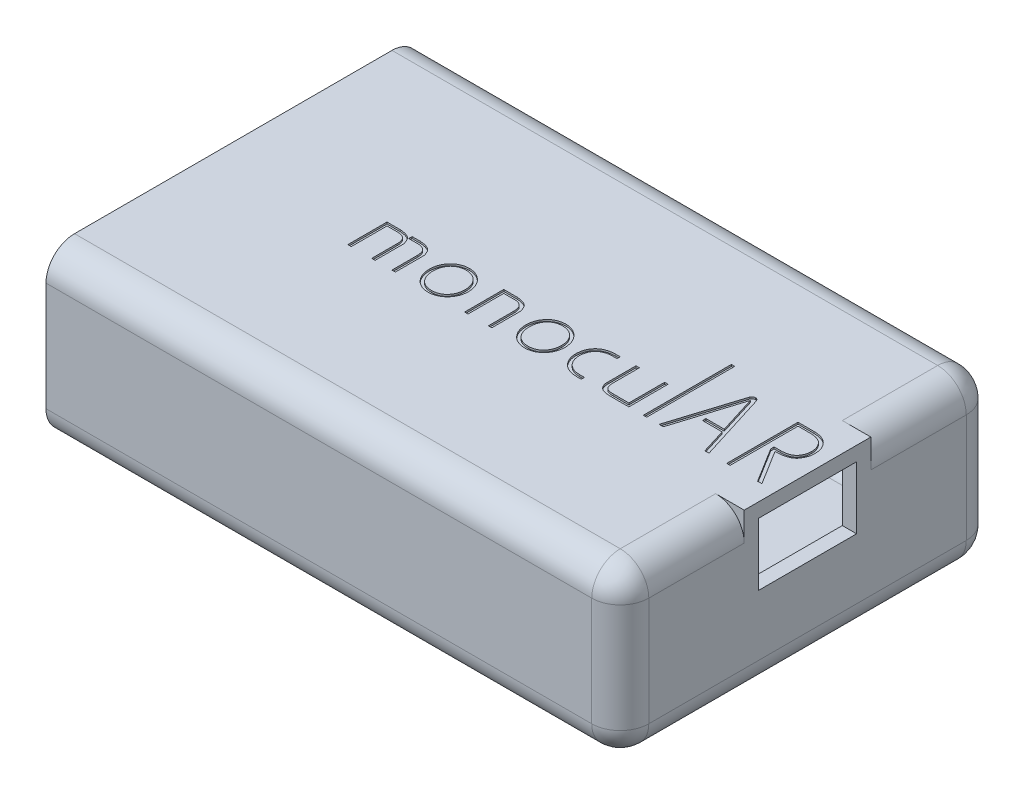
from build123d import *

# Parameters (mm, degrees)
SKETCH1_W                      = 64
SKETCH1_H                      = 42
BOSS_EXTRUDE1_DEPTH            = 1.6
SKETCH2_W                      = 64
SKETCH2_H                      = 42
SKETCH2_W_2                    = 60.8
SKETCH2_H_2                    = 38.8
BOSS_EXTRUDE2_DEPTH            = 17
SKETCH3_W                      = 60.8
SKETCH3_H                      = 5
BOSS_EXTRUDE3_DEPTH            = 5
SKETCH4_W                      = 11
SKETCH4_H                      = 8
CUT_EXTRUDE1_DEPTH             = 5
SKETCH5_R                      = 2
CUT_EXTRUDE2_DEPTH             = 5
CUT_EXTRUDE3_DEPTH             = 5
LPATTERN1_COUNT                = 2
LPATTERN1_PITCH                = 7
SKETCH6_W                      = 60.8
SKETCH6_H                      = 38.8
BOSS_EXTRUDE4_DEPTH            = 1.6
CUT_EXTRUDE8_REACH             = 53.216
SKETCH17_W                     = 9
SKETCH17_H                     = 3.4
CUT_EXTRUDE8_DIRECTION_2_REACH = 53.216
FILLET1_R                      = 1.6
FILLET2_R                      = 3.2
BOSS_EXTRUDE5_START            = -7.1
BOSS_EXTRUDE5_DEPTH            = 14.2
BOSS_EXTRUDE5_2_DEPTH          = 1.6
BOSS_EXTRUDE5_START_2          = 5.5
BOSS_EXTRUDE5_3_DEPTH          = 1.6
SKETCH19_W                     = 0.37518747
SKETCH19_H                     = 9.870561159
CUT_EXTRUDE9_DEPTH             = 0.2
CUT_EXTRUDE10_DEPTH            = 1.6
BOSS_EXTRUDE6_START            = 2
BOSS_EXTRUDE6_DEPTH            = 2


# Read off the part's stored shape, not the designer's step: Boss-Extrude5
with BuildPart() as part:
    # Sketch1 → Boss-Extrude1 (new body)
    with BuildSketch(Plane(origin=(0, 0, 0), x_dir=(1, 0, 0), z_dir=(0, 1, 0))):
        Rectangle(SKETCH1_W, SKETCH1_H)
    extrude(amount=BOSS_EXTRUDE1_DEPTH)

    # Sketch2 → Boss-Extrude2 (add)
    with BuildSketch(Plane(origin=(0, 1.6, 0), x_dir=(1, 0, 0), z_dir=(0, 1, 0))):
        Rectangle(SKETCH2_W, SKETCH2_H)
        Rectangle(SKETCH2_W_2, SKETCH2_H_2, mode=Mode.SUBTRACT)
    extrude(amount=BOSS_EXTRUDE2_DEPTH)

    # Sketch3 → Boss-Extrude3 (add)
    with BuildSketch(Plane(origin=(0, 1.6, 0), x_dir=(1, 0, 0), z_dir=(0, 1, 0))):
        with Locations((0, 16.9)):
            Rectangle(SKETCH3_W, SKETCH3_H)
        with Locations((0, -16.9)):
            Rectangle(SKETCH3_W, SKETCH3_H)
    boss_extrude3 = extrude(amount=BOSS_EXTRUDE3_DEPTH)

    # Sketch4 → Cut-Extrude1 (cut)
    with BuildSketch(Plane(origin=(32, 0, 0), x_dir=(0, 0, -1), z_dir=(1, 0, 0))):
        with Locations((0, 14)):
            Rectangle(SKETCH4_W, SKETCH4_H)
    extrude(amount=-CUT_EXTRUDE1_DEPTH, mode=Mode.SUBTRACT)

    # Sketch5 → Cut-Extrude2 (cut)
    with BuildSketch(Plane.ZY.offset(32)):
        with Locations((0, 12)):
            Circle(SKETCH5_R)
    extrude(amount=-CUT_EXTRUDE2_DEPTH, mode=Mode.SUBTRACT)

    # Sketch7 → Cut-Extrude3 (cut)
    with BuildSketch(Plane(origin=(0, 6.6, 0), x_dir=(1, 0, 0), z_dir=(0, 1, 0))):
        Polygon((-26.4, 14.4), (-21.4, 19.4), (21.4, 19.4), (26.4, 14.4), align=None)
        Polygon((21.4, -19.4), (26.4, -14.4), (-26.4, -14.4), (-21.4, -19.4), align=None)
    cut_extrude3 = extrude(amount=-CUT_EXTRUDE3_DEPTH, mode=Mode.SUBTRACT)

    # LPattern1: Boss-Extrude3, Cut-Extrude3 ×2
    with Locations(*[(0, i * LPATTERN1_PITCH, 0) for i in range(1, LPATTERN1_COUNT)]):
        add(boss_extrude3)
        add(cut_extrude3, mode=Mode.SUBTRACT)

    # Sketch6 → Boss-Extrude4 (add)
    with BuildSketch(Plane(origin=(0, 18.6, 0), x_dir=(1, 0, 0), z_dir=(0, 1, 0))):
        Rectangle(SKETCH6_W, SKETCH6_H)
    extrude(amount=-BOSS_EXTRUDE4_DEPTH)

    # Cut-Extrude8: up to this face of the body (flat: up to its plane)
    cut_extrude8_end = Plane(part.part.faces().sort_by_distance((0, 9.704590649, -19.4))[0])
    # Sketch17 → Cut-Extrude8 (cut, up to the picked face)
    with BuildSketch(Plane.XY.offset(-14.4), mode=Mode.PRIVATE) as cut_extrude8_sk1:
        with Locations((-25.9, 11.9)):
            Rectangle(SKETCH17_W, SKETCH17_H)
    cut_extrude8_tool1 = split(extrude(cut_extrude8_sk1.sketch, amount=-CUT_EXTRUDE8_REACH, mode=Mode.PRIVATE), bisect_by=cut_extrude8_end, keep=Keep.BOTH, mode=Mode.PRIVATE)
    # Sketch17 → Cut-Extrude8 (cut, up to the picked face)
    with BuildSketch(Plane.XY.offset(-14.4), mode=Mode.PRIVATE) as cut_extrude8_sk2:
        with Locations((25.9, 11.9)):
            Rectangle(SKETCH17_W, SKETCH17_H)
    cut_extrude8_tool2 = split(extrude(cut_extrude8_sk2.sketch, amount=-CUT_EXTRUDE8_REACH, mode=Mode.PRIVATE), bisect_by=cut_extrude8_end, keep=Keep.BOTH, mode=Mode.PRIVATE)
    # Sketch17 → Cut-Extrude8 (cut, up to the picked face)
    with BuildSketch(Plane.XY.offset(-14.4), mode=Mode.PRIVATE) as cut_extrude8_sk3:
        with Locations((-25.9, 3.3)):
            Rectangle(SKETCH17_W, SKETCH17_H)
    cut_extrude8_tool3 = split(extrude(cut_extrude8_sk3.sketch, amount=-CUT_EXTRUDE8_REACH, mode=Mode.PRIVATE), bisect_by=cut_extrude8_end, keep=Keep.BOTH, mode=Mode.PRIVATE)
    # Sketch17 → Cut-Extrude8 (cut, up to the picked face)
    with BuildSketch(Plane.XY.offset(-14.4), mode=Mode.PRIVATE) as cut_extrude8_sk4:
        with Locations((25.9, 3.3)):
            Rectangle(SKETCH17_W, SKETCH17_H)
    cut_extrude8_tool4 = split(extrude(cut_extrude8_sk4.sketch, amount=-CUT_EXTRUDE8_REACH, mode=Mode.PRIVATE), bisect_by=cut_extrude8_end, keep=Keep.BOTH, mode=Mode.PRIVATE)
    add(cut_extrude8_tool1.solids().sort_by(Axis((-25.9, 11.9, -14.4), (0, 0, -1)))[0], mode=Mode.SUBTRACT)
    add(cut_extrude8_tool2.solids().sort_by(Axis((25.9, 11.9, -14.4), (0, 0, -1)))[0], mode=Mode.SUBTRACT)
    add(cut_extrude8_tool3.solids().sort_by(Axis((-25.9, 3.3, -14.4), (0, 0, -1)))[0], mode=Mode.SUBTRACT)
    add(cut_extrude8_tool4.solids().sort_by(Axis((25.9, 3.3, -14.4), (0, 0, -1)))[0], mode=Mode.SUBTRACT)

    # Cut-Extrude8 direction 2: up to this face of the body (flat: up to its plane)
    cut_extrude8_direction_2_end = Plane(part.part.faces().sort_by_distance((0, 9.704590649, 19.4))[0])
    # Sketch17 → Cut-Extrude8 direction 2 (cut, up to the picked face)
    with BuildSketch(Plane.XY.offset(-14.4), mode=Mode.PRIVATE) as cut_extrude8_direction_2_sk1:
        with Locations((-25.9, 11.9)):
            Rectangle(SKETCH17_W, SKETCH17_H)
    cut_extrude8_direction_2_tool1 = split(extrude(cut_extrude8_direction_2_sk1.sketch, amount=CUT_EXTRUDE8_DIRECTION_2_REACH, mode=Mode.PRIVATE), bisect_by=cut_extrude8_direction_2_end, keep=Keep.BOTH, mode=Mode.PRIVATE)
    # Sketch17 → Cut-Extrude8 direction 2 (cut, up to the picked face)
    with BuildSketch(Plane.XY.offset(-14.4), mode=Mode.PRIVATE) as cut_extrude8_direction_2_sk2:
        with Locations((25.9, 11.9)):
            Rectangle(SKETCH17_W, SKETCH17_H)
    cut_extrude8_direction_2_tool2 = split(extrude(cut_extrude8_direction_2_sk2.sketch, amount=CUT_EXTRUDE8_DIRECTION_2_REACH, mode=Mode.PRIVATE), bisect_by=cut_extrude8_direction_2_end, keep=Keep.BOTH, mode=Mode.PRIVATE)
    # Sketch17 → Cut-Extrude8 direction 2 (cut, up to the picked face)
    with BuildSketch(Plane.XY.offset(-14.4), mode=Mode.PRIVATE) as cut_extrude8_direction_2_sk3:
        with Locations((-25.9, 3.3)):
            Rectangle(SKETCH17_W, SKETCH17_H)
    cut_extrude8_direction_2_tool3 = split(extrude(cut_extrude8_direction_2_sk3.sketch, amount=CUT_EXTRUDE8_DIRECTION_2_REACH, mode=Mode.PRIVATE), bisect_by=cut_extrude8_direction_2_end, keep=Keep.BOTH, mode=Mode.PRIVATE)
    # Sketch17 → Cut-Extrude8 direction 2 (cut, up to the picked face)
    with BuildSketch(Plane.XY.offset(-14.4), mode=Mode.PRIVATE) as cut_extrude8_direction_2_sk4:
        with Locations((25.9, 3.3)):
            Rectangle(SKETCH17_W, SKETCH17_H)
    cut_extrude8_direction_2_tool4 = split(extrude(cut_extrude8_direction_2_sk4.sketch, amount=CUT_EXTRUDE8_DIRECTION_2_REACH, mode=Mode.PRIVATE), bisect_by=cut_extrude8_direction_2_end, keep=Keep.BOTH, mode=Mode.PRIVATE)
    add(cut_extrude8_direction_2_tool1.solids().sort_by(Axis((-25.9, 11.9, -14.4), (0, 0, 1)))[0], mode=Mode.SUBTRACT)
    add(cut_extrude8_direction_2_tool2.solids().sort_by(Axis((25.9, 11.9, -14.4), (0, 0, 1)))[0], mode=Mode.SUBTRACT)
    add(cut_extrude8_direction_2_tool3.solids().sort_by(Axis((-25.9, 3.3, -14.4), (0, 0, 1)))[0], mode=Mode.SUBTRACT)
    add(cut_extrude8_direction_2_tool4.solids().sort_by(Axis((25.9, 3.3, -14.4), (0, 0, 1)))[0], mode=Mode.SUBTRACT)

    # Fillet1
    fillet1_edges = [part.edges().sort_by_distance(p)[0] for p in [
        (0, 1.6, 19.4),
        (30.4, 7.6, -19.4),
        (30.4, 7.6, 19.4),
        (30.4, 13.6, -19.4),
        (30.4, 13.6, 19.4),
        (30.4, 17, -12.45),
        (30.4, 17, 12.45),
        (0, 17, 19.4),
        (0, 17, -19.4),
        (30.4, 3.3, 19.4),
        (30.4, 3.3, -19.4),
        (30.4, 1.6, 0),
        (0, 1.6, -19.4),
    ]]
    fillet(fillet1_edges, radius=FILLET1_R)

    # Fillet2
    # the kernel refuses this fillet: 3.2 mm, written as the material it takes off along each edge
    with BuildSketch(Plane(origin=(28.8, 3.2, -17.8), x_dir=(0, -1, 0), z_dir=(0, 0, -1))) as fillet2_piece_1_section:
        Polygon((0, 0), (FILLET2_R, 0), (FILLET2_R, -FILLET2_R), (0, -FILLET2_R), align=None)
    fillet2_piece_1 = extrude(amount=FILLET2_R, mode=Mode.PRIVATE)
    fillet2_piece_1 = fillet2_piece_1 - Plane(origin=(28.8, 3.2, -17.8), x_dir=(-0.7071067811865475, 0.7071067811865475, 0), z_dir=(0, 0, -1)) * Sphere(FILLET2_R, mode=Mode.PRIVATE)
    add(fillet2_piece_1, mode=Mode.SUBTRACT)
    with BuildSketch(Plane(origin=(28.8, 15.4, -17.8), x_dir=(0, 1, 0), z_dir=(0, 0, -1))) as fillet2_piece_2_section:
        Polygon((0, 0), (FILLET2_R, 0), (FILLET2_R, FILLET2_R), (0, FILLET2_R), align=None)
    fillet2_piece_2 = extrude(amount=FILLET2_R, mode=Mode.PRIVATE)
    fillet2_piece_2 = fillet2_piece_2 - Plane(origin=(28.8, 15.4, -17.8), x_dir=(-0.7071067811865475, -0.7071067811865475, 0), z_dir=(0, 0, -1)) * Sphere(FILLET2_R, mode=Mode.PRIVATE)
    add(fillet2_piece_2, mode=Mode.SUBTRACT)
    with BuildSketch(Plane(origin=(28.8, 3.2, 17.8), x_dir=(0, 0, 1), z_dir=(0, -1, 0))) as fillet2_piece_3_section:
        Polygon((0, 0), (FILLET2_R, 0), (FILLET2_R, -FILLET2_R), (0, -FILLET2_R), align=None)
    fillet2_piece_3 = extrude(amount=FILLET2_R, mode=Mode.PRIVATE)
    fillet2_piece_3 = fillet2_piece_3 - Plane(origin=(28.8, 3.2, 17.8), x_dir=(-0.7071067811865475, 0, -0.7071067811865475), z_dir=(0, -1, 0)) * Sphere(FILLET2_R, mode=Mode.PRIVATE)
    add(fillet2_piece_3, mode=Mode.SUBTRACT)
    with BuildSketch(Plane(origin=(28.8, 15.4, 17.8), x_dir=(0, 0, 1), z_dir=(0, 1, 0))) as fillet2_piece_4_section:
        Polygon((0, 0), (FILLET2_R, 0), (FILLET2_R, FILLET2_R), (0, FILLET2_R), align=None)
    fillet2_piece_4 = extrude(amount=FILLET2_R, mode=Mode.PRIVATE)
    fillet2_piece_4 = fillet2_piece_4 - Plane(origin=(28.8, 15.4, 17.8), x_dir=(-0.7071067811865475, 0, -0.7071067811865475), z_dir=(0, 1, 0)) * Sphere(FILLET2_R, mode=Mode.PRIVATE)
    add(fillet2_piece_4, mode=Mode.SUBTRACT)
    with BuildSketch(Plane(origin=(-40, 0, -21), x_dir=(0, 1, 0), z_dir=(1, 0, 0)), Plane(origin=(28.8, 18.6, -21), x_dir=(0, -1, 0), z_dir=(-1, 0, 0))) as fillet2_piece_5:
        with BuildLine():
            CenterArc((FILLET2_R, FILLET2_R), FILLET2_R, 180, 90)
            Line((0, FILLET2_R), (0, 0))
            Line((0, 0), (FILLET2_R, 0))
        make_face()
    extrude(amount=68.8, mode=Mode.SUBTRACT)
    with BuildSketch(Plane(origin=(28.8, 0, 21), x_dir=(0, 0, -1), z_dir=(-1, 0, 0)), Plane(origin=(-40, 18.6, 21), x_dir=(0, 0, -1), z_dir=(1, 0, 0))) as fillet2_piece_6:
        with BuildLine():
            CenterArc((FILLET2_R, -FILLET2_R), FILLET2_R, 90, 90)
            Line((0, -FILLET2_R), (0, 0))
            Line((0, 0), (FILLET2_R, 0))
        make_face()
    extrude(amount=68.8, mode=Mode.SUBTRACT)
    with BuildSketch(Plane(origin=(32, 15.4, 21), x_dir=(0, 0, -1), z_dir=(0, -1, 0))) as fillet2_piece_7:
        with BuildLine():
            CenterArc((FILLET2_R, -FILLET2_R), FILLET2_R, 90, 90)
            Line((0, -FILLET2_R), (0, 0))
            Line((0, 0), (FILLET2_R, 0))
        make_face()
    extrude(amount=12.2, mode=Mode.SUBTRACT)
    with BuildSketch(Plane(origin=(32, 0, -17.8), x_dir=(0, 1, 0), z_dir=(0, 0, 1)), Plane(origin=(32, 18.6, 17.8), x_dir=(0, -1, 0), z_dir=(0, 0, -1))) as fillet2_piece_8:
        with BuildLine():
            CenterArc((FILLET2_R, FILLET2_R), FILLET2_R, 180, 90)
            Line((0, FILLET2_R), (0, 0))
            Line((0, 0), (FILLET2_R, 0))
        make_face()
    extrude(amount=35.6, mode=Mode.SUBTRACT)
    with BuildSketch(Plane(origin=(32, 15.4, -21), x_dir=(0, 0, 1), z_dir=(0, -1, 0))) as fillet2_piece_9:
        with BuildLine():
            CenterArc((FILLET2_R, FILLET2_R), FILLET2_R, 180, 90)
            Line((0, FILLET2_R), (0, 0))
            Line((0, 0), (FILLET2_R, 0))
        make_face()
    extrude(amount=12.2, mode=Mode.SUBTRACT)

    # Boss-Extrude5 outline → Boss-Extrude5 (add)
    with BuildSketch(Plane.XY.offset(BOSS_EXTRUDE5_START)):
        with BuildLine():
            Line((32, 17), (32, 18.6))
            Line((32, 18.6), (28.8, 18.6))
            ThreePointArc((28.8, 18.6), (29.779795897, 18.446309242), (30.665475811, 18))
            ThreePointArc((30.665475811, 18), (31.171682759, 17.548283243), (31.571281292, 17))
            Line((31.571281292, 17), (32, 17))
        make_face()
    extrude(amount=BOSS_EXTRUDE5_DEPTH)

    # Boss-Extrude5 2 outline → Boss-Extrude5 2 (add)
    with BuildSketch(Plane.XY.offset(BOSS_EXTRUDE5_START)):
        with BuildLine():
            Line((32, 15.4), (32, 17))
            Line((32, 17), (31.571281292, 17))
            ThreePointArc((31.571281292, 17), (31.890962644, 16.228220944), (32, 15.4))
        make_face()
    extrude(amount=BOSS_EXTRUDE5_2_DEPTH)

    # Boss-Extrude5 3 outline → Boss-Extrude5 3 (add)
    with BuildSketch(Plane.XY.offset(BOSS_EXTRUDE5_START_2)):
        with BuildLine():
            Line((32, 15.4), (32, 17))
            Line((32, 17), (31.571281292, 17))
            ThreePointArc((31.571281292, 17), (31.890962644, 16.228220944), (32, 15.4))
        make_face()
    extrude(amount=BOSS_EXTRUDE5_3_DEPTH)

    # Sketch19 → Cut-Extrude9 (cut)
    # profile 1 of 10: a face of its own
    with BuildSketch(Plane(origin=(0, 18.6, 0), x_dir=(1, 0, 0), z_dir=(0, 1, 0))):
        with BuildLine():
            Line((-16.010923418, 0.466698399), (-16.010923418, -3.54165131))
            Line((-16.010923418, -3.54165131), (-15.626787865, -3.54165131))
            Line((-15.626787865, -3.54165131), (-15.626787865, 0.466698399))
            Line((-15.626787865, 0.466698399), (-14.331548275, 0.466698399))
            add(Edge.make_bspline(
                [(-14.331548275, 0.466698399), (-14.253475036, 0.460378168), (-14.105901252, 0.448431687), (-13.90020776, 0.389229621), (-13.723683027, 0.297116206), (-13.579520364, 0.165418622), (-13.469134971, -0.002697445), (-13.393136522, -0.205112996), (-13.347333695, -0.440095566), (-13.343045309, -0.607532122), (-13.340775922, -0.696138514)],
                knots=[0, 0, 0, 0, 1.080076416, 2.041556939, 2.936302262, 3.807490633, 4.708824137, 5.689062843, 6.777066318, 8, 8, 8, 8], degree=3))
            Line((-13.340775922, -0.696138514), (-13.338690279, -3.54165131))
            Line((-13.338690279, -3.54165131), (-12.954554726, -3.54165131))
            Line((-12.954554726, -3.54165131), (-12.954554726, -0.383255309))
            add(Edge.make_bspline(
                [(-12.954554726, -0.383255309), (-12.951988732, -0.374874265), (-12.945515282, -0.3537307), (-12.9505077, -0.311905207), (-12.96378939, -0.25663612), (-12.984171838, -0.185663133), (-13.017111711, -0.102235459), (-13.056524647, -0.003004378), (-13.107040956, 0.109991937), (-13.162208059, 0.236189372), (-13.235106532, 0.364978223), (-13.339148699, 0.48047547), (-13.47006548, 0.578744701), (-13.6237069, 0.665866131), (-13.805657274, 0.732184535), (-14.010522641, 0.789518442), (-14.242334666, 0.827621269), (-14.405386113, 0.842836541), (-14.491088781, 0.850833952)],
                knots=[0, 0, 0, 0, 0.190487936, 0.480559988, 0.902239325, 1.442553576, 2.093856515, 2.866747362, 3.781625319, 4.804915956, 5.88479137, 7.007821731, 8.181851069, 9.458321067, 10.862678076, 12.412439398, 14.114315935, 16, 16, 16, 16], degree=3))
            Line((-14.491088781, 0.850833952), (-16.010923418, 0.850833952))
            Line((-16.010923418, 0.850833952), (-16.010923418, 0.466698399))
        make_face()
    # profile 2 of 10: a face of its own
    with BuildSketch(Plane(origin=(0, 18.6, 0), x_dir=(1, 0, 0), z_dir=(0, 1, 0))):
        with BuildLine():
            add(Edge.make_bspline(
                [(-10.683156557, -0.383255309), (-10.680590564, -0.374874266), (-10.674117117, -0.353730702), (-10.679109504, -0.311905191), (-10.692391398, -0.256636221), (-10.712772739, -0.185662598), (-10.745718115, -0.102238088), (-10.785104369, -0.002991664), (-10.835746701, 0.109932183), (-10.890504767, 0.236774434), (-10.966125313, 0.364958938), (-11.072173747, 0.481243082), (-11.207330058, 0.578603011), (-11.365471336, 0.666328086), (-11.553807898, 0.732378947), (-11.766373392, 0.789416339), (-12.007145769, 0.827730361), (-12.17643809, 0.842862493), (-12.26561962, 0.850833952)],
                knots=[0, 0, 0, 0, 0.186906199, 0.47152404, 0.885274559, 1.415429305, 2.054485822, 2.812844037, 3.710519583, 4.714569331, 5.781820712, 6.893741821, 8.0695373, 9.348175478, 10.76811625, 12.34650486, 14.075374696, 16, 16, 16, 16], degree=3))
            Line((-12.26561962, 0.850833952), (-13.187783888, 0.850833952))
            Line((-13.187783888, 0.850833952), (-13.187783888, 0.466698399))
            Line((-13.187783888, 0.466698399), (-12.100768164, 0.466698399))
            add(Edge.make_bspline(
                [(-12.100768164, 0.466698399), (-12.02034799, 0.460215758), (-11.867120404, 0.447864137), (-11.653138933, 0.390122498), (-11.469488255, 0.29716924), (-11.31892504, 0.166444318), (-11.203788013, -0.001914268), (-11.125976172, -0.204974136), (-11.077871866, -0.439910119), (-11.072316063, -0.60750319), (-11.069377753, -0.696138514)],
                knots=[0, 0, 0, 0, 1.093525226, 2.083534787, 2.987622984, 3.864660519, 4.760769052, 5.727247019, 6.798004018, 8, 8, 8, 8], degree=3))
            Line((-11.069377753, -0.696138514), (-11.06729211, -3.54165131))
            Line((-11.06729211, -3.54165131), (-10.683156557, -3.54165131))
            Line((-10.683156557, -3.54165131), (-10.683156557, -0.383255309))
        make_face()
    # profile 3 of 10: a face of its own
    with BuildSketch(Plane(origin=(0, 18.6, 0), x_dir=(1, 0, 0), z_dir=(0, 1, 0))):
        with BuildLine():
            add(Edge.make_bspline(
                [(-9.063117255, -1.345464745), (-9.060321184, -1.426962283), (-9.054827551, -1.587086117), (-9.023210395, -1.821179207), (-8.972536934, -2.0437091), (-8.90612723, -2.255836706), (-8.82072125, -2.456897249), (-8.714644446, -2.646447572), (-8.592041389, -2.825686609), (-8.451943653, -2.992502511), (-8.298249426, -3.145159135), (-8.130456351, -3.278702687), (-7.952354744, -3.395120782), (-7.761529534, -3.489242143), (-7.559237583, -3.561501469), (-7.347440366, -3.619164382), (-7.122739897, -3.65501781), (-6.968602441, -3.661506694), (-6.889838109, -3.664822518)],
                knots=[0, 0, 0, 0, 1.103541761, 2.168204605, 3.192193797, 4.190415089, 5.173943997, 6.143977171, 7.126603096, 8.109770911, 9.089139204, 10.054401994, 11.008286044, 11.964772276, 12.927502712, 13.912519732, 14.933296334, 16, 16, 16, 16], degree=3))
            add(Edge.make_bspline(
                [(-6.889838109, -3.664822518), (-6.812457816, -3.661510282), (-6.660386917, -3.655000941), (-6.437243982, -3.618565821), (-6.225183883, -3.561962114), (-6.02180689, -3.488815872), (-5.829100263, -3.394649741), (-5.647127962, -3.278904197), (-5.475122508, -3.144661465), (-5.315378835, -2.992667082), (-5.168920508, -2.826433676), (-5.042111442, -2.646572025), (-4.93228958, -2.456582113), (-4.83984713, -2.25653327), (-4.769043004, -2.04413206), (-4.717563708, -1.821048058), (-4.680344512, -1.588064041), (-4.673896922, -1.428364129), (-4.670631994, -1.347495342)],
                knots=[0, 0, 0, 0, 1.041884041, 2.047552901, 3.035970889, 3.993177267, 4.952581385, 5.916775597, 6.891200033, 7.885151451, 8.880955202, 9.868662672, 10.84236638, 11.831627444, 12.829939575, 13.85016276, 14.91136616, 16, 16, 16, 16], degree=3))
            add(Edge.make_bspline(
                [(-4.670631994, -1.347495342), (-4.673829533, -1.265925116), (-4.680090529, -1.106205165), (-4.717709307, -0.873246555), (-4.769535333, -0.650351228), (-4.838759978, -0.43730418), (-4.933529197, -0.237652378), (-5.041357276, -0.046604106), (-5.169030541, 0.13347079), (-5.315349291, 0.299780159), (-5.475130248, 0.451754251), (-5.647125929, 0.586002301), (-5.829100802, 0.701746445), (-6.021806746, 0.795912948), (-6.225183923, 0.86905909), (-6.437243971, 0.925662825), (-6.66038692, 0.962097938), (-6.812457817, 0.968607279), (-6.889838109, 0.971919516)],
                knots=[0, 0, 0, 0, 1.097395747, 2.14877417, 3.168450105, 4.175104593, 5.155331468, 6.1366309, 7.123808562, 8.119078161, 9.112496422, 10.086398174, 11.05007519, 12.008964682, 12.965657613, 13.953545411, 14.958674828, 16, 16, 16, 16], degree=3))
            add(Edge.make_bspline(
                [(-6.889838109, 0.971919516), (-6.96860244, 0.968603692), (-7.122739895, 0.962114807), (-7.347440377, 0.926261385), (-7.559237545, 0.868598447), (-7.761529676, 0.796339214), (-7.952354222, 0.702217509), (-8.130458306, 0.585800702), (-8.298241986, 0.452252263), (-8.451971905, 0.299614203), (-8.591935571, 0.132728574), (-8.715382713, -0.046754074), (-8.819520384, -0.237285781), (-8.907174976, -0.438047001), (-8.972021788, -0.650759365), (-9.02321461, -0.873105431), (-9.054420656, -1.106587333), (-9.061554866, -1.265987234), (-9.065202899, -1.347495342)],
                knots=[0, 0, 0, 0, 1.066702549, 2.087478082, 3.072494072, 4.0352235, 4.991708731, 5.945591781, 6.910853561, 7.890220829, 8.873387614, 9.856012511, 10.834291492, 11.809161745, 12.816367771, 13.840355892, 14.895679955, 16, 16, 16, 16], degree=3))
            Line((-9.065202899, -1.347495342), (-9.063117255, -1.345464745))
        make_face()
        with BuildLine():
            add(Edge.make_bspline(
                [(-5.054767546, -1.345464745), (-5.057944741, -1.417199766), (-5.06410199, -1.556218737), (-5.089673236, -1.759295806), (-5.128124563, -1.951869675), (-5.185286717, -2.132997621), (-5.254363543, -2.304758915), (-5.339156704, -2.465933293), (-5.443831382, -2.614013689), (-5.556833886, -2.75425708), (-5.685187126, -2.880108329), (-5.82508112, -2.990701246), (-5.975639602, -3.086071485), (-6.139053252, -3.159854714), (-6.309695381, -3.224497789), (-6.493612061, -3.267402463), (-6.687953785, -3.2945139), (-6.821551248, -3.300562058), (-6.889838109, -3.303653507)],
                knots=[0, 0, 0, 0, 1.144191134, 2.217386596, 3.259459877, 4.269939636, 5.240162759, 6.207846027, 7.164788291, 8.126348535, 9.075479422, 10.023118219, 10.964961006, 11.907848399, 12.876421374, 13.869210842, 14.910870754, 16, 16, 16, 16], degree=3))
            add(Edge.make_bspline(
                [(-6.889838109, -3.303653507), (-6.956736939, -3.300574746), (-7.087569356, -3.294553686), (-7.278403398, -3.267195243), (-7.45955185, -3.224443418), (-7.627653256, -3.160322181), (-7.787413797, -3.08594216), (-7.933885608, -2.990696371), (-8.069704537, -2.879432685), (-8.195543027, -2.754078076), (-8.307193722, -2.615246966), (-8.404600999, -2.464538125), (-8.48729895, -2.304302993), (-8.558104614, -2.133790107), (-8.608264723, -1.951021689), (-8.649225621, -1.75957742), (-8.67130193, -1.556749802), (-8.676375031, -1.418520579), (-8.678981703, -1.347495342)],
                knots=[0, 0, 0, 0, 1.079055746, 2.110283099, 3.103401418, 4.072403231, 5.005680082, 5.93922659, 6.880091456, 7.831993628, 8.797352075, 9.746407505, 10.719815072, 11.701013372, 12.716499627, 13.770360854, 14.854362019, 16, 16, 16, 16], degree=3))
            add(Edge.make_bspline(
                [(-8.678981703, -1.347495342), (-8.677574397, -1.27502803), (-8.674832058, -1.133815011), (-8.647808161, -0.928222124), (-8.611378869, -0.733195562), (-8.559453, -0.5492189), (-8.492075575, -0.376673692), (-8.411063435, -0.215349072), (-8.313847133, -0.06603995), (-8.203888681, 0.071559225), (-8.080013754, 0.195588857), (-7.944512734, 0.303520512), (-7.798993063, 0.397402262), (-7.640644968, 0.472187964), (-7.47219687, 0.532647062), (-7.292459962, 0.576742512), (-7.10222078, 0.604157688), (-6.971350582, 0.608520373), (-6.904451884, 0.610750505)],
                knots=[0, 0, 0, 0, 1.167804111, 2.275634908, 3.338515576, 4.365000222, 5.352667078, 6.321154111, 7.270405372, 8.220187015, 9.156417295, 10.090426067, 11.008665255, 11.942134682, 12.907496715, 13.889923244, 14.921363384, 16, 16, 16, 16], degree=3))
            add(Edge.make_bspline(
                [(-6.904451884, 0.610750505), (-6.836855739, 0.608532644), (-6.704596742, 0.604193163), (-6.511646902, 0.576496918), (-6.32842569, 0.532655071), (-6.155773656, 0.472262633), (-5.992945844, 0.396917947), (-5.841560491, 0.30369161), (-5.69972607, 0.19581814), (-5.569787987, 0.071077037), (-5.451175291, -0.065097114), (-5.348079612, -0.215227364), (-5.260136353, -0.375921215), (-5.189001207, -0.54908327), (-5.132887144, -0.733009328), (-5.091606163, -0.927899493), (-5.063195964, -1.133743457), (-5.059003672, -1.27502395), (-5.05685319, -1.347495342)],
                knots=[0, 0, 0, 0, 1.073143684, 2.099718979, 3.088559366, 4.059962913, 4.999099724, 5.931387382, 6.877194696, 7.822808389, 8.786325756, 9.739461532, 10.708537456, 11.689320721, 12.70633849, 13.757356679, 14.849611292, 16, 16, 16, 16], degree=3))
            Line((-5.05685319, -1.347495342), (-5.054767546, -1.345464745))
        make_face(mode=Mode.SUBTRACT)
    # profile 4 of 10: a face of its own
    with BuildSketch(Plane(origin=(0, 18.6, 0), x_dir=(1, 0, 0), z_dir=(0, 1, 0))):
        with BuildLine():
            Line((-2.916981035, 0.466698399), (-2.916981035, -3.54165131))
            Line((-2.916981035, -3.54165131), (-2.532845482, -3.54165131))
            Line((-2.532845482, -3.54165131), (-2.532845482, 0.466698399))
            Line((-2.532845482, 0.466698399), (-1.237605892, 0.466698399))
            add(Edge.make_bspline(
                [(-1.237605892, 0.466698399), (-1.159532652, 0.460378168), (-1.011958868, 0.448431687), (-0.806265377, 0.389229621), (-0.629740644, 0.297116206), (-0.485577981, 0.165418622), (-0.375192588, -0.002697445), (-0.299194139, -0.205112996), (-0.253391312, -0.440095566), (-0.249102926, -0.607532122), (-0.246833539, -0.696138514)],
                knots=[0, 0, 0, 0, 1.080076416, 2.041556939, 2.936302262, 3.807490633, 4.708824137, 5.689062843, 6.777066318, 8, 8, 8, 8], degree=3))
            Line((-0.246833539, -0.696138514), (-0.244747895, -3.54165131))
            Line((-0.244747895, -3.54165131), (0.139387657, -3.54165131))
            Line((0.139387657, -3.54165131), (0.139387657, -0.383255309))
            add(Edge.make_bspline(
                [(0.139387657, -0.383255309), (0.141954265, -0.374874042), (0.148429261, -0.353729913), (0.143417767, -0.311911368), (0.130259297, -0.256597404), (0.10927748, -0.186095172), (0.079750128, -0.101676871), (0.038905896, -0.00353643), (-0.008639711, 0.110080184), (-0.061701917, 0.236646385), (-0.135027673, 0.364919388), (-0.238907646, 0.48049056), (-0.369868705, 0.578747071), (-0.523507272, 0.665836035), (-0.706045688, 0.732551866), (-0.912453296, 0.789436902), (-1.146308306, 0.827628329), (-1.310746745, 0.842840916), (-1.397146398, 0.850833952)],
                knots=[0, 0, 0, 0, 0.190161812, 0.479737249, 0.900694653, 1.440083863, 2.08508518, 2.856652805, 3.763984635, 4.779268397, 5.857295018, 6.978402703, 8.150422052, 9.42470668, 10.82665937, 12.388445711, 14.102408186, 16, 16, 16, 16], degree=3))
            Line((-1.397146398, 0.850833952), (-2.916981035, 0.850833952))
            Line((-2.916981035, 0.850833952), (-2.916981035, 0.466698399))
        make_face()
    # profile 5 of 10: a face of its own
    with BuildSketch(Plane(origin=(0, 18.6, 0), x_dir=(1, 0, 0), z_dir=(0, 1, 0))):
        with BuildLine():
            add(Edge.make_bspline(
                [(1.759426959, -1.345464745), (1.76222303, -1.426962283), (1.767716664, -1.587086117), (1.79933382, -1.821179207), (1.850007281, -2.0437091), (1.916416985, -2.255836706), (2.001822964, -2.456897249), (2.107899769, -2.646447572), (2.230502826, -2.825686609), (2.370600562, -2.992502511), (2.524294789, -3.145159135), (2.692087864, -3.278702687), (2.87018947, -3.395120782), (3.06101468, -3.489242143), (3.263306631, -3.561501469), (3.475103849, -3.619164382), (3.699804317, -3.65501781), (3.853941774, -3.661506694), (3.932706106, -3.664822518)],
                knots=[0, 0, 0, 0, 1.103541761, 2.168204605, 3.192193797, 4.190415089, 5.173943997, 6.143977171, 7.126603096, 8.109770911, 9.089139204, 10.054401994, 11.008286044, 11.964772276, 12.927502712, 13.912519732, 14.933296334, 16, 16, 16, 16], degree=3))
            add(Edge.make_bspline(
                [(3.932706106, -3.664822518), (4.010086399, -3.661510282), (4.162157298, -3.655000941), (4.385300233, -3.618565821), (4.597360332, -3.561962114), (4.800737325, -3.488815872), (4.993443952, -3.394649741), (5.175416253, -3.278904197), (5.347421706, -3.144661465), (5.50716538, -2.992667082), (5.653623707, -2.826433676), (5.780432773, -2.646572025), (5.890254635, -2.456582113), (5.982697084, -2.25653327), (6.053501211, -2.04413206), (6.104980507, -1.821048058), (6.142199703, -1.588064041), (6.148647293, -1.428364129), (6.151912221, -1.347495342)],
                knots=[0, 0, 0, 0, 1.041884041, 2.047552901, 3.035970889, 3.993177267, 4.952581385, 5.916775597, 6.891200033, 7.885151451, 8.880955202, 9.868662672, 10.84236638, 11.831627444, 12.829939575, 13.85016276, 14.91136616, 16, 16, 16, 16], degree=3))
            add(Edge.make_bspline(
                [(6.151912221, -1.347495342), (6.148714682, -1.265925116), (6.142453686, -1.106205165), (6.104834908, -0.873246555), (6.053008882, -0.650351228), (5.983784237, -0.43730418), (5.889015017, -0.237652378), (5.781186938, -0.046604106), (5.653513674, 0.13347079), (5.507194924, 0.299780159), (5.347413966, 0.451754251), (5.175418286, 0.586002301), (4.993443412, 0.701746445), (4.800737469, 0.795912948), (4.597360292, 0.86905909), (4.385300244, 0.925662825), (4.162157295, 0.962097938), (4.010086398, 0.968607279), (3.932706106, 0.971919516)],
                knots=[0, 0, 0, 0, 1.097395747, 2.14877417, 3.168450105, 4.175104593, 5.155331468, 6.1366309, 7.123808562, 8.119078161, 9.112496422, 10.086398174, 11.05007519, 12.008964682, 12.965657613, 13.953545411, 14.958674828, 16, 16, 16, 16], degree=3))
            add(Edge.make_bspline(
                [(3.932706106, 0.971919516), (3.853941775, 0.968603692), (3.69980432, 0.962114807), (3.475103838, 0.926261385), (3.26330667, 0.868598447), (3.061014539, 0.796339214), (2.870189993, 0.702217509), (2.692085909, 0.585800702), (2.524302229, 0.452252263), (2.370572309, 0.299614203), (2.230608643, 0.132728574), (2.107161501, -0.046754074), (2.003023831, -0.237285781), (1.915369238, -0.438047001), (1.850522427, -0.650759365), (1.799329605, -0.873105431), (1.768123559, -1.106587333), (1.760989348, -1.265987234), (1.757341316, -1.347495342)],
                knots=[0, 0, 0, 0, 1.066702549, 2.087478082, 3.072494072, 4.0352235, 4.991708731, 5.945591781, 6.910853561, 7.890220829, 8.873387614, 9.856012511, 10.834291492, 11.809161745, 12.816367771, 13.840355892, 14.895679955, 16, 16, 16, 16], degree=3))
            Line((1.757341316, -1.347495342), (1.759426959, -1.345464745))
        make_face()
        with BuildLine():
            add(Edge.make_bspline(
                [(5.767776669, -1.345464745), (5.764599474, -1.417199766), (5.758442225, -1.556218737), (5.732870979, -1.759295806), (5.694419652, -1.951869675), (5.637257498, -2.132997621), (5.568180672, -2.304758915), (5.483387511, -2.465933293), (5.378712833, -2.614013689), (5.265710329, -2.75425708), (5.137357089, -2.880108329), (4.997463095, -2.990701246), (4.846904613, -3.086071485), (4.683490962, -3.159854714), (4.512848833, -3.224497789), (4.328932153, -3.267402463), (4.134590429, -3.2945139), (4.000992967, -3.300562058), (3.932706106, -3.303653507)],
                knots=[0, 0, 0, 0, 1.144191134, 2.217386596, 3.259459877, 4.269939636, 5.240162759, 6.207846027, 7.164788291, 8.126348535, 9.075479422, 10.023118219, 10.964961006, 11.907848399, 12.876421374, 13.869210842, 14.910870754, 16, 16, 16, 16], degree=3))
            add(Edge.make_bspline(
                [(3.932706106, -3.303653507), (3.865807276, -3.300574746), (3.734974859, -3.294553686), (3.544140817, -3.267195243), (3.362992365, -3.224443418), (3.194890958, -3.160322181), (3.035130418, -3.08594216), (2.888658606, -2.990696371), (2.752839678, -2.879432685), (2.627001188, -2.754078076), (2.515350492, -2.615246966), (2.417943216, -2.464538125), (2.335245265, -2.304302993), (2.264439601, -2.133790107), (2.214279492, -1.951021689), (2.173318594, -1.75957742), (2.151242284, -1.556749802), (2.146169184, -1.418520579), (2.143562512, -1.347495342)],
                knots=[0, 0, 0, 0, 1.079055746, 2.110283099, 3.103401418, 4.072403231, 5.005680082, 5.93922659, 6.880091456, 7.831993628, 8.797352075, 9.746407505, 10.719815072, 11.701013372, 12.716499627, 13.770360854, 14.854362019, 16, 16, 16, 16], degree=3))
            add(Edge.make_bspline(
                [(2.143562512, -1.347495342), (2.144969818, -1.27502803), (2.147712157, -1.133815011), (2.174736054, -0.928222124), (2.211165346, -0.733195562), (2.263091215, -0.5492189), (2.33046864, -0.376673692), (2.41148078, -0.215349072), (2.508697082, -0.06603995), (2.618655534, 0.071559225), (2.74253046, 0.195588857), (2.878031481, 0.303520512), (3.023551152, 0.397402262), (3.181899247, 0.472187964), (3.350347345, 0.532647062), (3.530084253, 0.576742512), (3.720323435, 0.604157688), (3.851193633, 0.608520373), (3.918092331, 0.610750505)],
                knots=[0, 0, 0, 0, 1.167804111, 2.275634908, 3.338515576, 4.365000222, 5.352667078, 6.321154111, 7.270405372, 8.220187015, 9.156417295, 10.090426067, 11.008665255, 11.942134682, 12.907496715, 13.889923244, 14.921363384, 16, 16, 16, 16], degree=3))
            add(Edge.make_bspline(
                [(3.918092331, 0.610750505), (3.985688476, 0.608532644), (4.117947473, 0.604193163), (4.310897313, 0.576496918), (4.494118525, 0.532655071), (4.666770558, 0.472262633), (4.82959837, 0.396917947), (4.980983723, 0.30369161), (5.122818145, 0.19581814), (5.252756227, 0.071077037), (5.371368924, -0.065097114), (5.474464603, -0.215227364), (5.562407862, -0.375921215), (5.633543007, -0.54908327), (5.68965707, -0.733009328), (5.730938052, -0.927899493), (5.75934825, -1.133743457), (5.763540543, -1.27502395), (5.765691025, -1.347495342)],
                knots=[0, 0, 0, 0, 1.073143684, 2.099718979, 3.088559366, 4.059962913, 4.999099724, 5.931387382, 6.877194696, 7.822808389, 8.786325756, 9.739461532, 10.708537456, 11.689320721, 12.70633849, 13.757356679, 14.849611292, 16, 16, 16, 16], degree=3))
            Line((5.765691025, -1.347495342), (5.767776669, -1.345464745))
        make_face(mode=Mode.SUBTRACT)
    # profile 6 of 10: a face of its own
    with BuildSketch(Plane(origin=(0, 18.6, 0), x_dir=(1, 0, 0), z_dir=(0, 1, 0))):
        with BuildLine():
            add(Edge.make_bspline(
                [(7.371116552, -1.37323051), (7.37223175, -1.444809028), (7.374421381, -1.585349671), (7.406302932, -1.791606197), (7.450601787, -1.990632094), (7.517011316, -2.181487064), (7.597450432, -2.366252428), (7.699488541, -2.54193875), (7.815997163, -2.712094631), (7.951756176, -2.87210987), (8.103125696, -3.021071042), (8.273676093, -3.151191023), (8.460373213, -3.261726493), (8.663036389, -3.354855026), (8.882466211, -3.426922994), (9.117266153, -3.480911275), (9.367986278, -3.517186397), (9.540791529, -3.525059313), (9.629990667, -3.529123179)],
                knots=[0, 0, 0, 0, 0.98162875, 1.927376226, 2.858976433, 3.777404474, 4.696974623, 5.621247221, 6.562011569, 7.524688872, 8.497551524, 9.472054557, 10.46165986, 11.470537585, 12.527915407, 13.626359305, 14.774766954, 16, 16, 16, 16], degree=3))
            Line((9.629990667, -3.529123179), (10.150679796, -3.529123179))
            Line((10.150679796, -3.529123179), (10.150679796, -3.170039812))
            Line((10.150679796, -3.170039812), (9.587898591, -3.170039812))
            add(Edge.make_bspline(
                [(9.587898591, -3.170039812), (9.521838435, -3.167593721), (9.392620885, -3.162809024), (9.203726907, -3.138349364), (9.025619177, -3.094948822), (8.855310495, -3.042502622), (8.69590606, -2.969863702), (8.54501303, -2.884827032), (8.404291825, -2.783266493), (8.273173073, -2.669081611), (8.154008379, -2.542454121), (8.051275981, -2.403193172), (7.962959277, -2.254252035), (7.890455552, -2.095138045), (7.83029315, -1.9265298), (7.790444956, -1.746910867), (7.761459298, -1.557173043), (7.757359133, -1.426944424), (7.755252105, -1.360021435)],
                knots=[0, 0, 0, 0, 1.099271252, 2.150239208, 3.160981428, 4.145671976, 5.109389509, 6.068438414, 7.022444819, 7.990462516, 8.956817903, 9.908293036, 10.863141707, 11.831643707, 12.81272195, 13.834734899, 14.887295183, 16, 16, 16, 16], degree=3))
            add(Edge.make_bspline(
                [(7.755252105, -1.360021435), (7.757372023, -1.287546241), (7.761484548, -1.146948304), (7.789924042, -0.94318226), (7.830684848, -0.752068815), (7.88872235, -0.573939036), (7.964858582, -0.409959185), (8.054931223, -0.258692679), (8.15987048, -0.119307111), (8.281129116, 0.005400986), (8.415183193, 0.116192495), (8.559990089, 0.21275284), (8.715339817, 0.294533804), (8.881182718, 0.361231788), (9.05707947, 0.414283543), (9.244194161, 0.447995133), (9.440772688, 0.472384079), (9.575630389, 0.475529896), (9.644604442, 0.477138848)],
                knots=[0, 0, 0, 0, 1.166977021, 2.263872, 3.308141299, 4.311177895, 5.27402164, 6.213956898, 7.141989079, 8.077302171, 9.008644783, 9.938097164, 10.8756237, 11.830936158, 12.813218902, 13.828763992, 14.889503926, 16, 16, 16, 16], degree=3))
            Line((9.644604442, 0.477138848), (10.150679796, 0.479224492))
            Line((10.150679796, 0.479224492), (10.150679796, 0.838307859))
            Line((10.150679796, 0.838307859), (9.631189453, 0.838307859))
            add(Edge.make_bspline(
                [(9.631189453, 0.838307859), (9.543013022, 0.834733117), (9.372098214, 0.827804097), (9.123742666, 0.796305133), (8.891474562, 0.747099918), (8.675165714, 0.677323323), (8.47313958, 0.59207603), (8.286417598, 0.487682913), (8.115783615, 0.363199392), (7.961772565, 0.2210484), (7.823520967, 0.06458585), (7.704086946, -0.106109826), (7.601636786, -0.287730765), (7.516746988, -0.481932052), (7.453480043, -0.688961487), (7.404953792, -0.906594254), (7.375042613, -1.136515248), (7.371071199, -1.293820569), (7.369030909, -1.37463521)],
                knots=[0, 0, 0, 0, 1.186132784, 2.299113912, 3.361712605, 4.373713125, 5.350451841, 6.305619535, 7.243257181, 8.183598705, 9.118384178, 10.045127427, 10.979397649, 11.91806182, 12.888731404, 13.885345848, 14.913609444, 16, 16, 16, 16], degree=3))
            Line((7.369030909, -1.37463521), (7.371116552, -1.37323051))
        make_face()
    # profile 7 of 10: a face of its own
    with BuildSketch(Plane(origin=(0, 18.6, 0), x_dir=(1, 0, 0), z_dir=(0, 1, 0))):
        with BuildLine():
            add(Edge.make_bspline(
                [(11.913912889, -2.279394651), (11.912514715, -2.365685956), (11.909821418, -2.531908561), (11.962584593, -2.770427586), (12.053481102, -2.98665894), (12.164745662, -3.148260586), (12.281185541, -3.260073523), (12.389899912, -3.333739066), (12.518793509, -3.395860451), (12.667185977, -3.447971392), (12.835628428, -3.48569745), (13.022133091, -3.518216579), (13.229534996, -3.53577613), (13.374569738, -3.539631972), (13.450448983, -3.541649271)],
                knots=[0, 0, 0, 0, 1.344956396, 2.590784262, 3.784730157, 4.994767627, 5.625607472, 6.298372808, 7.037738181, 7.856446887, 8.750774399, 9.732439442, 10.813658142, 12, 12, 12, 12], degree=3))
            Line((13.450448983, -3.541649271), (15.504728209, -3.541649271))
            Line((15.504728209, -3.541649271), (15.504728209, 0.850833952))
            Line((15.504728209, 0.850833952), (15.120592657, 0.850833952))
            Line((15.120592657, 0.850833952), (15.120592657, -3.157513719))
            Line((15.120592657, -3.157513719), (13.3754331, -3.157513719))
            add(Edge.make_bspline(
                [(13.3754331, -3.157513719), (13.281921224, -3.157874383), (13.108963446, -3.158541462), (12.870856809, -3.114483122), (12.675037425, -3.041915019), (12.544074892, -2.947266923), (12.468391818, -2.850281177), (12.420130494, -2.765830987), (12.380829599, -2.667931422), (12.3472252, -2.557009736), (12.323038036, -2.431764953), (12.306519886, -2.293626705), (12.298774403, -2.142299008), (12.29829768, -2.037133011), (12.298048442, -1.982150713)],
                knots=[0, 0, 0, 0, 1.776870931, 3.286466492, 4.582912327, 5.727514429, 6.302683217, 6.913945309, 7.573275005, 8.306698591, 9.117300371, 9.99804655, 10.95334991, 12, 12, 12, 12], degree=3))
            Line((12.298048442, -1.982150713), (12.298048442, 0.850833952))
            Line((12.298048442, 0.850833952), (11.913912889, 0.850833952))
            Line((11.913912889, 0.850833952), (11.913912889, -2.279394651))
        make_face()
    # profile 8 of 10: a face of its own
    with BuildSketch(Plane(origin=(0, 18.6, 0), x_dir=(1, 0, 0), z_dir=(0, 1, 0))):
        with Locations((17.316836307, 1.39362927)):
            Rectangle(SKETCH19_W, SKETCH19_H)
    # profile 9 of 10: a face of its own
    with BuildSketch(Plane(origin=(0, 18.6, 0), x_dir=(1, 0, 0), z_dir=(0, 1, 0))):
        with BuildLine():
            Line((21.692397888, 3.909473813), (23.019984319, -0.351670961))
            Line((23.019984319, -0.351670961), (20.956453236, -0.351670961))
            Line((20.956453236, -0.351670961), (20.956453236, -0.735806514))
            Line((20.956453236, -0.735806514), (23.164287192, -0.735806514))
            Line((23.164287192, -0.735806514), (24.030104429, -3.54165131))
            Line((24.030104429, -3.54165131), (24.491873622, -3.54165131))
            Line((24.491873622, -3.54165131), (22.082015645, 4.169475867))
            add(Edge.make_bspline(
                [(22.082015645, 4.169475867), (22.062853092, 4.212015577), (22.027218079, 4.291123157), (21.944664548, 4.386987509), (21.839345209, 4.448768601), (21.760236116, 4.455105999), (21.719757941, 4.45834869)],
                knots=[0, 0, 0, 0, 1.127067127, 2.095913546, 3.025725827, 4, 4, 4, 4], degree=3))
            add(Edge.make_bspline(
                [(21.719757941, 4.45834869), (21.678778807, 4.454443194), (21.593764416, 4.446340939), (21.476413838, 4.387635376), (21.371188024, 4.297380244), (21.33530221, 4.212064533), (21.316835288, 4.168160872)],
                knots=[0, 0, 0, 0, 0.927958871, 1.925122672, 2.932263348, 4, 4, 4, 4], degree=3))
            Line((21.316835288, 4.168160872), (18.892922153, -3.54165131))
            Line((18.892922153, -3.54165131), (19.369121633, -3.54165131))
            Line((19.369121633, -3.54165131), (21.692397888, 3.909473813))
        make_face()
    # profile 10 of 10: a face of its own
    with BuildSketch(Plane(origin=(0, 18.6, 0), x_dir=(1, 0, 0), z_dir=(0, 1, 0))):
        with BuildLine():
            Line((26.477583499, 4.458346651), (26.477583499, -3.54165131))
            Line((26.477583499, -3.54165131), (26.861719052, -3.54165131))
            Line((26.861719052, -3.54165131), (26.861719052, 4.074211099))
            Line((26.861719052, 4.074211099), (28.346073286, 4.074211099))
            add(Edge.make_bspline(
                [(28.346073286, 4.074211099), (28.42272294, 4.069003344), (28.57028973, 4.058977316), (28.78320249, 4.027351931), (28.979558456, 3.983097912), (29.157948661, 3.920161013), (29.319385908, 3.842233389), (29.463629475, 3.748723743), (29.590652823, 3.638928201), (29.732805276, 3.475417801), (29.874413397, 3.253195507), (30.000164466, 2.973690585), (30.075372311, 2.682912081), (30.080465046, 2.485913155), (30.083012594, 2.387368007)],
                knots=[0, 0, 0, 0, 1.015135616, 1.954350705, 2.842353141, 3.671474084, 4.448986472, 5.20671411, 5.937035975, 6.660431892, 8.06367328, 9.402013808, 10.700404418, 12, 12, 12, 12], degree=3))
            add(Edge.make_bspline(
                [(30.083012594, 2.387368007), (30.080786465, 2.279089479), (30.076421622, 2.066784264), (30.001020664, 1.759520977), (29.870989481, 1.476533327), (29.719608609, 1.263260783), (29.571336493, 1.110462585), (29.439749116, 1.00836093), (29.288981048, 0.924536344), (29.121528166, 0.851698111), (28.935259314, 0.797545935), (28.731918428, 0.75243462), (28.509534639, 0.726255679), (28.355170069, 0.720308116), (28.275079861, 0.717222295)],
                knots=[0, 0, 0, 0, 1.391288951, 2.727945307, 4.039127655, 5.381867722, 6.072559898, 6.77518181, 7.517645178, 8.288340227, 9.121758108, 10.011108448, 10.968087442, 12, 12, 12, 12], degree=3))
            Line((28.275079861, 0.717222295), (27.540280988, 0.717222295))
            Line((27.540280988, 0.717222295), (27.540280988, 0.333086742))
            Line((27.540280988, 0.333086742), (29.943521176, -3.54165131))
            Line((29.943521176, -3.54165131), (30.428067308, -3.54165131))
            Line((30.428067308, -3.54165131), (28.020929025, 0.333086742))
            Line((28.020929025, 0.333086742), (28.275389751, 0.333086742))
            add(Edge.make_bspline(
                [(28.275389751, 0.333086742), (28.383990741, 0.339035931), (28.592368561, 0.35045092), (28.889988398, 0.394006059), (29.158792933, 0.458968522), (29.400275606, 0.540179546), (29.61169429, 0.646039691), (29.795189093, 0.769069991), (29.95160682, 0.912068756), (30.109125059, 1.128247438), (30.259513373, 1.404848229), (30.392313469, 1.73212437), (30.470974395, 2.050259098), (30.469802598, 2.258934197), (30.46923379, 2.360228139)],
                knots=[0, 0, 0, 0, 1.157463014, 2.220878643, 3.196550733, 4.0985664, 4.926836027, 5.705585685, 6.444669568, 7.169204313, 8.542114626, 9.785733269, 10.925162575, 12, 12, 12, 12], degree=3))
            add(Edge.make_bspline(
                [(30.46923379, 2.360228139), (30.467210299, 2.437572754), (30.463257711, 2.588653904), (30.433004573, 2.80864342), (30.386924847, 3.016677536), (30.325928224, 3.213520642), (30.241769171, 3.39683492), (30.145733876, 3.570925663), (30.026184169, 3.730117832), (29.893279231, 3.87886904), (29.743294525, 4.012867365), (29.575948709, 4.127650285), (29.396539367, 4.228979823), (29.200919514, 4.310360151), (28.99010914, 4.372858559), (28.765055372, 4.417838683), (28.524980406, 4.447883944), (28.360071094, 4.453411966), (28.275079861, 4.456261008)],
                knots=[0, 0, 0, 0, 1.083102549, 2.115679016, 3.104251663, 4.066078132, 4.995447562, 5.925225867, 6.845450873, 7.777219866, 8.716251947, 9.65457544, 10.614622028, 11.59765236, 12.615352163, 13.689734435, 14.80933153, 16, 16, 16, 16], degree=3))
            Line((28.275079861, 4.456261008), (26.477583499, 4.458346651))
        make_face()
    extrude(amount=-CUT_EXTRUDE9_DEPTH, mode=Mode.SUBTRACT)

    # Sketch20 → Cut-Extrude10 (cut)
    with BuildSketch(Plane.ZY.offset(32)):
        with BuildLine():
            Line((17.8, 18.6), (-17.8, 18.6))
            ThreePointArc((-17.8, 18.6), (-20.0627417, 17.6627417), (-21, 15.4))
            Line((-21, 15.4), (-21, 3.2))
            ThreePointArc((-21, 3.2), (-20.0627417, 0.9372583), (-17.8, 0))
            Line((-17.8, 0), (17.8, 0))
            ThreePointArc((17.8, 0), (20.0627417, 0.9372583), (21, 3.2))
            Line((21, 3.2), (21, 15.4))
            ThreePointArc((21, 15.4), (20.0627417, 17.6627417), (17.8, 18.6))
        make_face()
    extrude(amount=-CUT_EXTRUDE10_DEPTH, mode=Mode.SUBTRACT)

    # Sketch21 → Boss-Extrude6 (add)
    with BuildSketch(Plane.ZY.offset(30.4).offset(BOSS_EXTRUDE6_START)):
        with BuildLine():
            Line((17.8, 18.6), (-17.8, 18.6))
            ThreePointArc((-17.8, 18.6), (-20.0627417, 17.6627417), (-21, 15.4))
            Line((-21, 15.4), (-21, 3.2))
            ThreePointArc((-21, 3.2), (-20.0627417, 0.9372583), (-17.8, 0))
            Line((-17.8, 0), (17.8, 0))
            ThreePointArc((17.8, 0), (20.0627417, 0.9372583), (21, 3.2))
            Line((21, 3.2), (21, 15.4))
            ThreePointArc((21, 15.4), (20.0627417, 17.6627417), (17.8, 18.6))
        make_face()
        with BuildLine():
            Line((17.8, 17), (-17.8, 17))
            ThreePointArc((-17.8, 17), (-18.93137085, 16.53137085), (-19.4, 15.4))
            Line((-19.4, 15.4), (-19.4, 3.2))
            ThreePointArc((-19.4, 3.2), (-18.93137085, 2.06862915), (-17.8, 1.6))
            Line((-17.8, 1.6), (17.8, 1.6))
            ThreePointArc((17.8, 1.6), (18.93137085, 2.06862915), (19.4, 3.2))
            Line((19.4, 3.2), (19.4, 15.4))
            ThreePointArc((19.4, 15.4), (18.93137085, 16.53137085), (17.8, 17))
        make_face(mode=Mode.SUBTRACT)
    extrude(amount=-BOSS_EXTRUDE6_DEPTH)


solid = part.part
